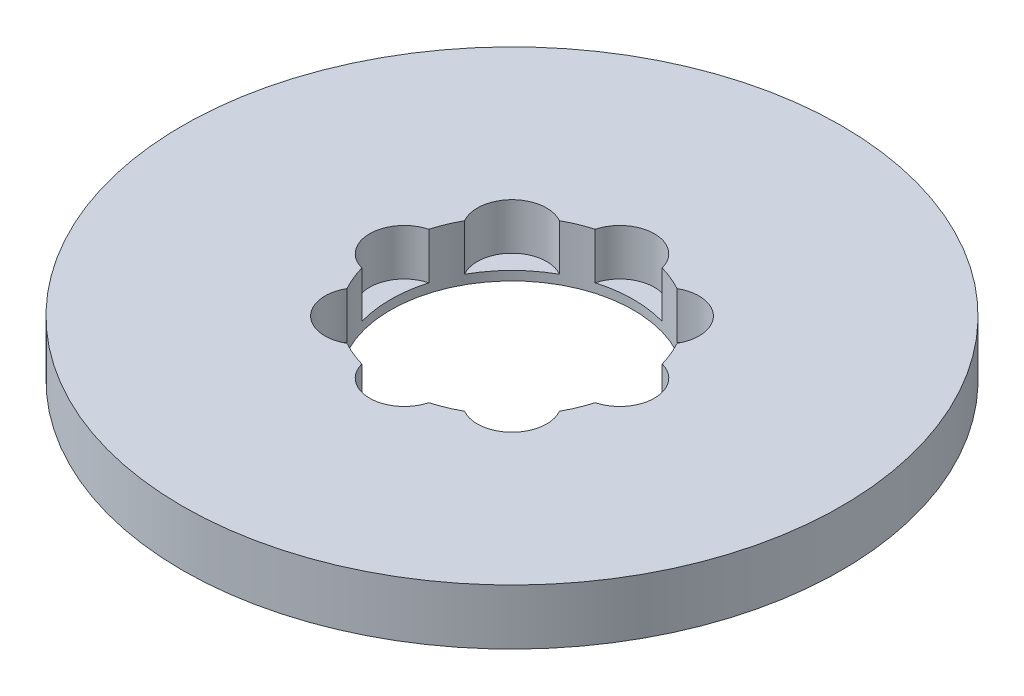
from build123d import *

# Parameters (mm, degrees)
SKETCH1_R           = 95
BOSS_EXTRUDE1_DEPTH = 16
SKETCH2_R           = 35
CUT_EXTRUDE1_DEPTH  = 136.299667405
SKETCH3_R           = 10
CUT_EXTRUDE2_DEPTH  = 13.369874265
CIRPATTERN1_COUNT   = 8


with BuildPart() as part:
    # Sketch1 → Boss-Extrude1 (new body)
    with BuildSketch(Plane(origin=(0, 0, 0), x_dir=(1, 0, 0), z_dir=(0, 1, 0))):
        Circle(SKETCH1_R)
    extrude(amount=BOSS_EXTRUDE1_DEPTH)

    # Sketch2 → Cut-Extrude1 (cut, through all)
    with BuildSketch(Plane(origin=(0, 0, 0), x_dir=(1, 0, 0), z_dir=(0, 1, 0))):
        Circle(SKETCH2_R)
    extrude(amount=CUT_EXTRUDE1_DEPTH, mode=Mode.SUBTRACT)

    # Sketch3 → Cut-Extrude2 (cut)
    with BuildSketch(Plane(origin=(0, 16, 0), x_dir=(1, 0, 0), z_dir=(0, 1, 0))):
        with Locations((-31.056865323, 0)):
            Circle(SKETCH3_R)
    cut_extrude2 = extrude(amount=-CUT_EXTRUDE2_DEPTH, mode=Mode.SUBTRACT)

    # CirPattern1: Cut-Extrude2 ×8 about axis
    cirpattern1_axis = Axis((0, 0, 0), (0, 1, 0))
    for i in range(1, CIRPATTERN1_COUNT):
        add(cut_extrude2.rotate(cirpattern1_axis, i * 360 / CIRPATTERN1_COUNT), mode=Mode.SUBTRACT)


solid = part.part
